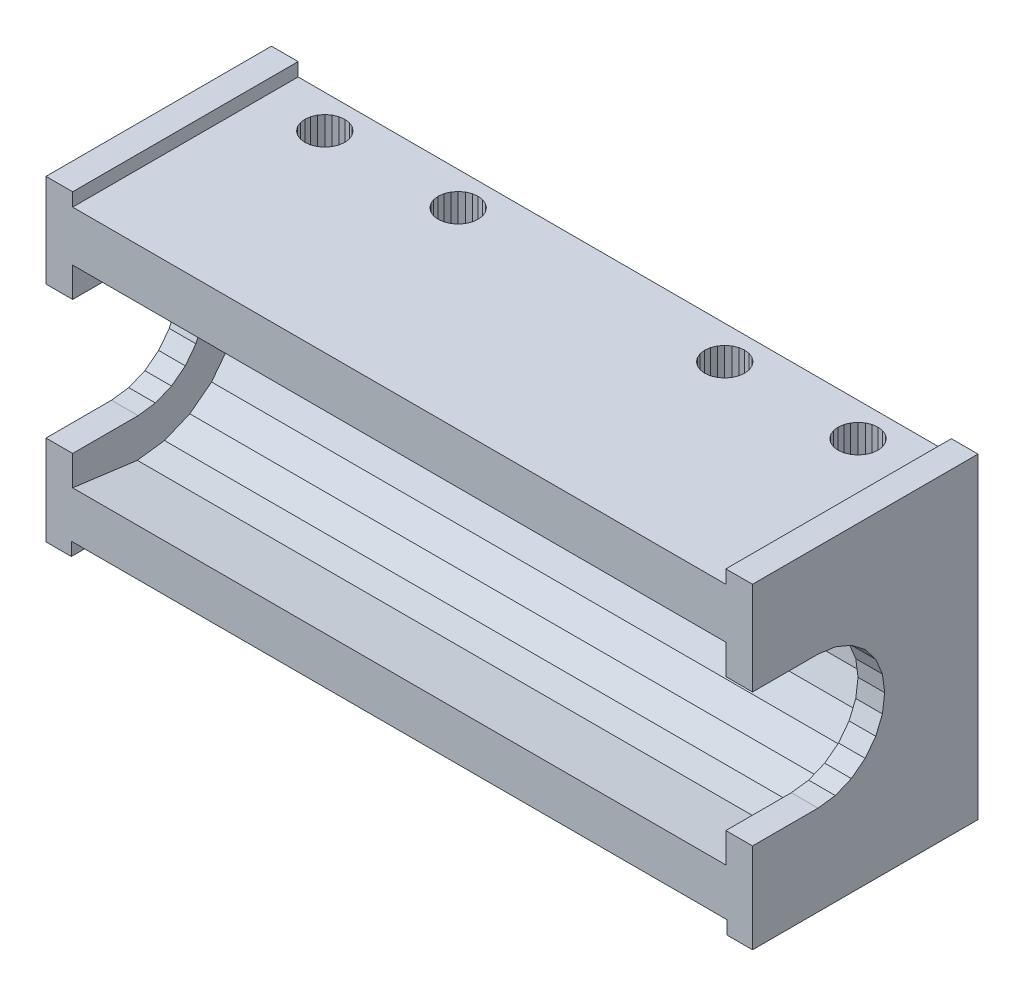
from build123d import *
from OCP.BRepAlgoAPI import BRepAlgoAPI_Cut
from OCP.TopTools import TopTools_ListOfShape

# Parameters (mm, degrees)
SKETCH1_W           = 53
SKETCH1_H           = 23.75
BOSS_EXTRUDE1_DEPTH = 16.915477654
SKETCH2_W           = 49.200000763
SKETCH2_H           = 1
CUT_EXTRUDE1_DEPTH  = 139.092000716
CUT_EXTRUDE2_DEPTH  = 5
CUT_EXTRUDE3_DEPTH  = 5
SKETCH5_W           = 49
SKETCH5_H           = 1
CUT_EXTRUDE4_DEPTH  = 139.092001054
CUT_EXTRUDE5_DEPTH  = 49
CUT_EXTRUDE6_DEPTH  = 103.148906689
CUT_EXTRUDE7_DEPTH  = 103.148906689
CUT_EXTRUDE8_DEPTH  = 110.725555532
CUT_EXTRUDE9_DEPTH  = 110.725555532
CUT_EXTRUDE10_DEPTH = 110.725555532
CUT_EXTRUDE11_DEPTH = 110.725555372


with BuildPart() as part:
    # Sketch1 → Boss-Extrude1 (new body)
    with BuildSketch(Plane(origin=(0, 0, 0), x_dir=(-1, 0, 0), z_dir=(-6.357495294169486e-14, 4.3711395392165194e-08, -0.9999999999999991))):
        with Locations((-79.500007629, 75)):
            Rectangle(SKETCH1_W, SKETCH1_H)
    extrude(amount=-BOSS_EXTRUDE1_DEPTH)


with BuildPart() as cut_extrude1_tool:
    # Sketch2 → Cut-Extrude1 (new, through all)
    with BuildSketch(Plane(origin=(0, -7.39e-07, 16.915477654), x_dir=(1, 0, 0), z_dir=(4.7168328154131204e-14, -4.371139599722196e-08, 0.9999999999999991))):
        with Locations((79.500005723, 63.625000739)):
            Rectangle(SKETCH2_W, SKETCH2_H)
    extrude(amount=-CUT_EXTRUDE1_DEPTH)


with BuildPart() as part_1:
    add(part.part)

    # Cut-Extrude1: cut by cut_extrude1_tool, with a tolerance
    cut_extrude1_stock = TopTools_ListOfShape()
    cut_extrude1_stock.Append(part_1.part.wrapped)
    cut_extrude1_tools = TopTools_ListOfShape()
    cut_extrude1_tools.Append(cut_extrude1_tool.part.wrapped)
    cut_extrude1_cut = BRepAlgoAPI_Cut()
    cut_extrude1_cut.SetArguments(cut_extrude1_stock)
    cut_extrude1_cut.SetTools(cut_extrude1_tools)
    cut_extrude1_cut.SetFuzzyValue(0.00001)
    cut_extrude1_cut.Build()
    add(Compound.cast(cut_extrude1_cut.Shape()).solids(), mode=Mode.REPLACE)

    # Sketch3 → Cut-Extrude2 (cut)
    with BuildSketch(Plane(origin=(0, 64.125000739, 2.803e-06), x_dir=(1, 0, 0), z_dir=(0, -0.9999999999999991, -4.371139599722195e-08))):
        Polygon((91.745307922, -2.661e-06), (91.745307922, 0.499997316), (92.900009155, 2.499997435), (91.200004578, 5.444483815), (87.800003052, 5.444483815), (86.100006104, 2.499997435), (87.254707336, 0.499997316), (87.254707336, -2.661e-06), align=None)
    extrude(amount=-CUT_EXTRUDE2_DEPTH, mode=Mode.SUBTRACT)

    # Sketch4 → Cut-Extrude3 (cut)
    with BuildSketch(Plane(origin=(0, 64.125000739, 2.803e-06), x_dir=(1, 0, 0), z_dir=(0, -0.9999999999999991, -4.371139599722195e-08))):
        Polygon((67.254707336, 0.499997316), (67.254707336, -2.661e-06), (71.745307922, -2.661e-06), (71.745307922, 0.499997316), (72.900009155, 2.499997435), (71.200004578, 5.444483815), (67.800003052, 5.444483815), (66.100006104, 2.499997435), align=None)
    extrude(amount=-CUT_EXTRUDE3_DEPTH, mode=Mode.SUBTRACT)

    # Sketch5 → Cut-Extrude4 (cut, through all)
    with BuildSketch(Plane(origin=(0, 0, 0), x_dir=(-1, 0, 0), z_dir=(-4.7168328154131204e-14, 4.371139599722196e-08, -0.9999999999999991))):
        with Locations((-79.500007629, 86.375)):
            Rectangle(SKETCH5_W, SKETCH5_H)
    extrude(amount=-CUT_EXTRUDE4_DEPTH, mode=Mode.SUBTRACT)


with BuildPart() as cut_extrude5_tool:
    # Sketch6 → Cut-Extrude5 (new body)
    with BuildSketch(Plane(origin=(104.000007629, 0, 0), x_dir=(0, 0, -1), z_dir=(1, 0, 0))):
        Polygon((-16.915477753, 82.111373901), (-16.915477753, 67.638626099), (-12.064613342, 67), (-10.026412964, 67.268333435), (-8.127113342, 68.055046082), (-6.496147633, 69.306533813), (-5.244663239, 70.9375), (-4.457947731, 72.836799622), (-4.189613819, 74.875), (-4.457947731, 76.913200378), (-5.244663715, 78.8125), (-6.496148109, 80.443466187), (-8.127114296, 81.694946289), (-10.026413918, 82.481666565), (-12.064614296, 82.75), align=None)
    extrude(amount=-CUT_EXTRUDE5_DEPTH)


with BuildPart() as part_2:
    add(part_1.part)

    # Cut-Extrude5: cut by cut_extrude5_tool, with a tolerance
    cut_extrude5_stock = TopTools_ListOfShape()
    cut_extrude5_stock.Append(part_2.part.wrapped)
    cut_extrude5_tools = TopTools_ListOfShape()
    cut_extrude5_tools.Append(cut_extrude5_tool.part.wrapped)
    cut_extrude5_cut = BRepAlgoAPI_Cut()
    cut_extrude5_cut.SetArguments(cut_extrude5_stock)
    cut_extrude5_cut.SetTools(cut_extrude5_tools)
    cut_extrude5_cut.SetFuzzyValue(0.00001)
    cut_extrude5_cut.Build()
    add(Compound.cast(cut_extrude5_cut.Shape()).solids(), mode=Mode.REPLACE)


with BuildPart() as cut_extrude6_tool:
    # Sketch7 → Cut-Extrude6 (new, through all)
    with BuildSketch(Plane.ZY.offset(-104.000007629)):
        Polygon((16.915477753, 69.875), (16.915477753, 79.875), (12.000000954, 79.875), (10.705905914, 79.704627991), (9.500000954, 79.205123901), (8.464467049, 78.41053009), (7.669873714, 77.375), (7.170371532, 76.1690979), (7.000000477, 74.875), (7.170371532, 73.5809021), (7.669873714, 72.375), (8.464466095, 71.33946228), (9.5, 70.544868469), (10.705904961, 70.045372009), (12, 69.875), align=None)
    extrude(amount=-CUT_EXTRUDE6_DEPTH)


with BuildPart() as part_3:
    add(part_2.part)

    # Cut-Extrude6: cut by cut_extrude6_tool, with a tolerance
    cut_extrude6_stock = TopTools_ListOfShape()
    cut_extrude6_stock.Append(part_3.part.wrapped)
    cut_extrude6_tools = TopTools_ListOfShape()
    cut_extrude6_tools.Append(cut_extrude6_tool.part.wrapped)
    cut_extrude6_cut = BRepAlgoAPI_Cut()
    cut_extrude6_cut.SetArguments(cut_extrude6_stock)
    cut_extrude6_cut.SetTools(cut_extrude6_tools)
    cut_extrude6_cut.SetFuzzyValue(0.00001)
    cut_extrude6_cut.Build()
    add(Compound.cast(cut_extrude6_cut.Shape()).solids(), mode=Mode.REPLACE)


with BuildPart() as cut_extrude7_tool:
    # Sketch8 → Cut-Extrude7 (new, through all)
    with BuildSketch(Plane(origin=(55.000007629, 0, 0), x_dir=(0, 0, -1), z_dir=(1, 0, 0))):
        Polygon((-16.915477753, 79.875), (-16.915477753, 69.875), (-12, 69.875), (-10.705904961, 70.045372009), (-9.5, 70.544868469), (-8.464466095, 71.33946228), (-7.669873714, 72.375), (-7.170371532, 73.5809021), (-7.000000477, 74.875), (-7.170371532, 76.1690979), (-7.669873714, 77.375), (-8.464467049, 78.41053009), (-9.500000954, 79.205123901), (-10.705905914, 79.704627991), (-12.000000954, 79.875), align=None)
    extrude(amount=-CUT_EXTRUDE7_DEPTH)


with BuildPart() as part_4:
    add(part_3.part)

    # Cut-Extrude7: cut by cut_extrude7_tool, with a tolerance
    cut_extrude7_stock = TopTools_ListOfShape()
    cut_extrude7_stock.Append(part_4.part.wrapped)
    cut_extrude7_tools = TopTools_ListOfShape()
    cut_extrude7_tools.Append(cut_extrude7_tool.part.wrapped)
    cut_extrude7_cut = BRepAlgoAPI_Cut()
    cut_extrude7_cut.SetArguments(cut_extrude7_stock)
    cut_extrude7_cut.SetTools(cut_extrude7_tools)
    cut_extrude7_cut.SetFuzzyValue(0.00001)
    cut_extrude7_cut.Build()
    add(Compound.cast(cut_extrude7_cut.Shape()).solids(), mode=Mode.REPLACE)

    # Sketch9 → Cut-Extrude8 (cut, through all)
    with BuildSketch(Plane(origin=(0, 85.875, 3.754e-06), x_dir=(-1, 0, 0), z_dir=(0, 0.9999999999999991, 4.371139599722195e-08))):
        Polygon((-98.051116943, 2.888225855), (-98.200965881, 3.249997438), (-98.439346313, 3.560657562), (-98.750007629, 3.799035372), (-99.111778259, 3.948885979), (-99.500007629, 3.9999972), (-99.888237, 3.948885979), (-100.250007629, 3.799035372), (-100.560668945, 3.560657562), (-100.799041748, 3.249997438), (-100.948898315, 2.888225855), (-101.000007629, 2.499997438), (-100.948898315, 2.111768784), (-100.799041748, 1.749997319), (-100.560668945, 1.439337195), (-100.250007629, 1.200959267), (-99.888237, 1.05110854), (-99.500007629, 0.999997319), (-99.111778259, 1.05110854), (-98.750007629, 1.200959267), (-98.439346313, 1.439337195), (-98.200965881, 1.749997319), (-98.051116943, 2.111768784), (-98.000007629, 2.499997438), align=None)
    extrude(amount=-CUT_EXTRUDE8_DEPTH, mode=Mode.SUBTRACT)

    # Sketch10 → Cut-Extrude9 (cut, through all)
    with BuildSketch(Plane(origin=(0, 85.875, 3.754e-06), x_dir=(-1, 0, 0), z_dir=(0, 0.9999999999999991, 4.371139599722195e-08))):
        Polygon((-70.799041748, 3.249997438), (-70.948898315, 2.888225855), (-71.000007629, 2.499997438), (-70.948898315, 2.111768784), (-70.799041748, 1.749997319), (-70.560668945, 1.439337195), (-70.250007629, 1.200959267), (-69.888237, 1.05110854), (-69.500007629, 0.999997319), (-69.111778259, 1.05110854), (-68.750007629, 1.200959267), (-68.439346313, 1.439337195), (-68.200965881, 1.749997319), (-68.051116943, 2.111768784), (-68.000007629, 2.499997438), (-68.051116943, 2.888225855), (-68.200965881, 3.249997438), (-68.439346313, 3.560657562), (-68.750007629, 3.799035372), (-69.111778259, 3.948885979), (-69.500007629, 3.9999972), (-69.888237, 3.948885979), (-70.250007629, 3.799035372), (-70.560668945, 3.560657562), align=None)
    extrude(amount=-CUT_EXTRUDE9_DEPTH, mode=Mode.SUBTRACT)

    # Sketch11 → Cut-Extrude10 (cut, through all)
    with BuildSketch(Plane(origin=(0, 85.875, 3.754e-06), x_dir=(-1, 0, 0), z_dir=(0, 0.9999999999999991, 4.371139599722195e-08))):
        Polygon((-88.051116943, 2.888225855), (-88.200965881, 3.249997438), (-88.439346313, 3.560657562), (-88.750007629, 3.799035372), (-89.111778259, 3.948885979), (-89.500007629, 3.9999972), (-89.888237, 3.948885979), (-90.250007629, 3.799035372), (-90.560668945, 3.560657562), (-90.799041748, 3.249997438), (-90.948898315, 2.888225855), (-91.000007629, 2.499997438), (-90.948898315, 2.111768784), (-90.799041748, 1.749997319), (-90.560668945, 1.439337195), (-90.250007629, 1.200959267), (-89.888237, 1.05110854), (-89.500007629, 0.999997319), (-89.111778259, 1.05110854), (-88.750007629, 1.200959267), (-88.439346313, 1.439337195), (-88.200965881, 1.749997319), (-88.051116943, 2.111768784), (-88.000007629, 2.499997438), align=None)
    extrude(amount=-CUT_EXTRUDE10_DEPTH, mode=Mode.SUBTRACT)

    # Sketch12 → Cut-Extrude11 (cut, through all)
    with BuildSketch(Plane(origin=(0, 64.125000739, 2.803e-06), x_dir=(1, 0, 0), z_dir=(0, -0.9999999999999991, -4.371139599722195e-08))):
        Polygon((60.799045563, 3.249997435), (60.560665131, 3.560657559), (60.250007629, 3.799035369), (59.888233185, 3.948885976), (59.500007629, 3.999997197), (59.111778259, 3.948885976), (58.750007629, 3.799035369), (58.439346313, 3.560657559), (58.200969696, 3.249997435), (58.051116943, 2.888225852), (58.000007629, 2.499997435), (58.051116943, 2.111768781), (58.200969696, 1.749997316), (58.439346313, 1.439337192), (58.750007629, 1.200959264), (59.111778259, 1.051108657), (59.500007629, 0.999997316), (59.888233185, 1.051108657), (60.250007629, 1.200959264), (60.560665131, 1.439337192), (60.799045563, 1.749997316), (60.948894501, 2.111768781), (61.000007629, 2.499997435), (60.948894501, 2.888225852), align=None)
    extrude(amount=-CUT_EXTRUDE11_DEPTH, mode=Mode.SUBTRACT)


solid = part_4.part
